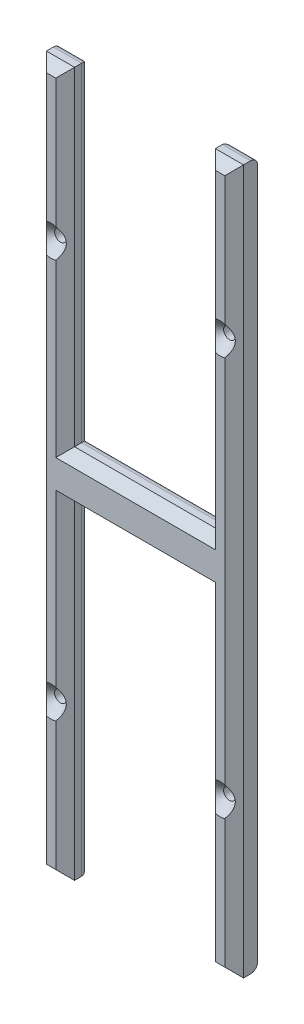
from build123d import *

# Parameters (mm, degrees)
SKETCH1_R           = 12.5
BOSS_EXTRUDE1_DEPTH = 50
CHAMFER1_SIZE       = 20
FILLET1_R           = 15
FILLET2_R           = 3


with BuildPart() as part:
    # Sketch1 → Boss-Extrude1 (new body)
    with BuildSketch(Plane.XY):
        Polygon((-210, 750), (-150, 750), (-150, 50), (150, 50), (150, 750), (210, 750), (210, -750), (150, -750), (150, -50), (-150, -50), (-150, -750), (-210, -750), align=None)
        with Locations((180, 425)):
            Circle(SKETCH1_R, mode=Mode.SUBTRACT)
        with Locations(Location((-180, 425, 0), (0, 0, 180))):
            Circle(SKETCH1_R, mode=Mode.SUBTRACT)
        with Locations(Location((180, -425, 0), (0, 0, 180))):
            Circle(SKETCH1_R, mode=Mode.SUBTRACT)
        with Locations((-180, -425)):
            Circle(SKETCH1_R, mode=Mode.SUBTRACT)
    extrude(amount=BOSS_EXTRUDE1_DEPTH)

    # Chamfer1
    # the kernel refuses this chamfer: 20 mm, written as the material it takes off along each edge
    with BuildSketch(Plane(origin=(-150, -50, 50), x_dir=(0.027495876610586317, 0, -0.9996219169112968), z_dir=(0, -1, 0)), Plane(origin=(150, -801.433659759, 50), x_dir=(-0.027495876610586317, 0, -0.9996219169112968), z_dir=(0, 1, 0)), Plane(origin=(150, 50, 50), x_dir=(-0.027495876610586317, 0, -0.9996219169112968), z_dir=(0, 1, 0)), Plane(origin=(-150, 801.433659759, 50), x_dir=(0.027495876610586317, 0, -0.9996219169112968), z_dir=(0, -1, 0))) as chamfer1_piece_1:
        Polygon((CHAMFER1_SIZE * 0.999621916911, -CHAMFER1_SIZE * 0.0274958766106), (-CHAMFER1_SIZE * 0.0274958766106, -CHAMFER1_SIZE * 0.999621916911), (0, 0), align=None)
    extrude(amount=751.433659759, mode=Mode.SUBTRACT)
    with BuildSketch(Plane(origin=(150, -50, 50), x_dir=(0, -0.027495876610586317, -0.9996219169112968), z_dir=(-1, 0, 0)), Plane(origin=(-150, 50, 50), x_dir=(0, 0.027495876610586317, -0.9996219169112968), z_dir=(1, 0, 0))) as chamfer1_piece_2:
        Polygon((CHAMFER1_SIZE * 0.999621916911, -CHAMFER1_SIZE * 0.0274958766106), (-CHAMFER1_SIZE * 0.0274958766106, -CHAMFER1_SIZE * 0.999621916911), (0, 0), align=None)
    extrude(amount=300, mode=Mode.SUBTRACT)
    with BuildSketch(Plane(origin=(261.433659759, -750, 50), x_dir=(0, -0.0274958766105877, -0.9996219169112968), z_dir=(-1, 0, 0)), Plane(origin=(98.566340241, 750, 50), x_dir=(0, 0.0274958766105877, -0.9996219169112968), z_dir=(1, 0, 0)), Plane(origin=(-261.433659759, 750, 50), x_dir=(0, 0.0274958766105877, -0.9996219169112968), z_dir=(1, 0, 0)), Plane(origin=(-98.566340241, -750, 50), x_dir=(0, -0.0274958766105877, -0.9996219169112968), z_dir=(-1, 0, 0))) as chamfer1_piece_3:
        Polygon((CHAMFER1_SIZE * 0.999621916911, -CHAMFER1_SIZE * 0.0274958766106), (-CHAMFER1_SIZE * 0.0274958766106, -CHAMFER1_SIZE * 0.999621916911), (0, 0), align=None)
    extrude(amount=162.867319519, mode=Mode.SUBTRACT)
    with BuildSketch(Plane(origin=(210, 801.433659759, 50), x_dir=(0.027495876610586317, 0, -0.9996219169112968), z_dir=(0, -1, 0)), Plane(origin=(-210, -801.433659759, 50), x_dir=(-0.027495876610586317, 0, -0.9996219169112968), z_dir=(0, 1, 0))) as chamfer1_piece_4:
        Polygon((CHAMFER1_SIZE * 0.999621916911, -CHAMFER1_SIZE * 0.0274958766106), (-CHAMFER1_SIZE * 0.0274958766106, -CHAMFER1_SIZE * 0.999621916911), (0, 0), align=None)
    extrude(amount=1602.867319519, mode=Mode.SUBTRACT)
    with BuildSketch(Plane(origin=(180, 425, 50), x_dir=(1, 0, 0), z_dir=(0, -1, 0))) as chamfer1_piece_5:
        Polygon((12.5, -CHAMFER1_SIZE), (12.5 + CHAMFER1_SIZE, 0), (12.5, 0), align=None)
    revolve(axis=Axis((180, 425, 50), (0, 0, 1)), mode=Mode.SUBTRACT)
    with BuildSketch(Plane(origin=(-180, 425, 50), x_dir=(-1, 0, 0), z_dir=(0, 1, 0))) as chamfer1_piece_6:
        Polygon((12.5, -CHAMFER1_SIZE), (12.5 + CHAMFER1_SIZE, 0), (12.5, 0), align=None)
    revolve(axis=Axis((-180, 425, 50), (0, 0, 1)), mode=Mode.SUBTRACT)
    with BuildSketch(Plane(origin=(180, -425, 50), x_dir=(-1, 0, 0), z_dir=(0, 1, 0))) as chamfer1_piece_7:
        Polygon((12.5, -CHAMFER1_SIZE), (12.5 + CHAMFER1_SIZE, 0), (12.5, 0), align=None)
    revolve(axis=Axis((180, -425, 50), (0, 0, 1)), mode=Mode.SUBTRACT)
    with BuildSketch(Plane(origin=(-180, -425, 50), x_dir=(1, 0, 0), z_dir=(0, -1, 0))) as chamfer1_piece_8:
        Polygon((12.5, -CHAMFER1_SIZE), (12.5 + CHAMFER1_SIZE, 0), (12.5, 0), align=None)
    revolve(axis=Axis((-180, -425, 50), (0, 0, 1)), mode=Mode.SUBTRACT)
    with BuildSketch(Plane(origin=(150, -50, 50), x_dir=(0, -0.027495876610586317, -0.9996219169112968), z_dir=(-1, 0, 0))) as chamfer1_piece_9a_section:
        Polygon((CHAMFER1_SIZE * 0.999621916911, -CHAMFER1_SIZE * 0.0274958766106), (-CHAMFER1_SIZE * 0.0274958766106, -CHAMFER1_SIZE * 0.999621916911), (0, 0), align=None)
    chamfer1_piece_9a = extrude(amount=351.433659759, mode=Mode.PRIVATE)
    chamfer1_piece_9a = split(chamfer1_piece_9a, bisect_by=Plane(origin=(-150, -43.404127464, 43.404127464), z_dir=(-1, 0, 0)), keep=Keep.TOP, mode=Mode.PRIVATE)
    with BuildSketch(Plane(origin=(-150, 1.433659759, 50), x_dir=(0.027495876610586317, 0, -0.9996219169112968), z_dir=(0, -1, 0))) as chamfer1_piece_9b_section:
        Polygon((CHAMFER1_SIZE * 0.999621916911, -CHAMFER1_SIZE * 0.0274958766106), (-CHAMFER1_SIZE * 0.0274958766106, -CHAMFER1_SIZE * 0.999621916911), (0, 0), align=None)
    chamfer1_piece_9b = extrude(amount=802.867319519, mode=Mode.PRIVATE)
    chamfer1_piece_9b = split(chamfer1_piece_9b, bisect_by=Plane(origin=(-156.595872536, -50, 43.404127464), z_dir=(0, 1, 0)), keep=Keep.TOP, mode=Mode.PRIVATE)
    chamfer1_piece_9 = chamfer1_piece_9a & chamfer1_piece_9b
    add(chamfer1_piece_9, mode=Mode.SUBTRACT)
    with BuildSketch(Plane(origin=(150, -801.433659759, 50), x_dir=(-0.027495876610586317, 0, -0.9996219169112968), z_dir=(0, 1, 0))) as chamfer1_piece_10a_section:
        Polygon((CHAMFER1_SIZE * 0.999621916911, -CHAMFER1_SIZE * 0.0274958766106), (-CHAMFER1_SIZE * 0.0274958766106, -CHAMFER1_SIZE * 0.999621916911), (0, 0), align=None)
    chamfer1_piece_10a = extrude(amount=802.867319519, mode=Mode.PRIVATE)
    chamfer1_piece_10a = split(chamfer1_piece_10a, bisect_by=Plane(origin=(156.595872536, -50, 43.404127464), z_dir=(0, 1, 0)), keep=Keep.TOP, mode=Mode.PRIVATE)
    with BuildSketch(Plane(origin=(201.433659759, -50, 50), x_dir=(0, -0.027495876610586317, -0.9996219169112968), z_dir=(-1, 0, 0))) as chamfer1_piece_10b_section:
        Polygon((CHAMFER1_SIZE * 0.999621916911, -CHAMFER1_SIZE * 0.0274958766106), (-CHAMFER1_SIZE * 0.0274958766106, -CHAMFER1_SIZE * 0.999621916911), (0, 0), align=None)
    chamfer1_piece_10b = extrude(amount=351.433659759, mode=Mode.PRIVATE)
    chamfer1_piece_10b = split(chamfer1_piece_10b, bisect_by=Plane(origin=(150, -43.404127464, 43.404127464), z_dir=(1, 0, 0)), keep=Keep.TOP, mode=Mode.PRIVATE)
    chamfer1_piece_10 = chamfer1_piece_10a & chamfer1_piece_10b
    add(chamfer1_piece_10, mode=Mode.SUBTRACT)
    with BuildSketch(Plane(origin=(-150, 50, 50), x_dir=(0, 0.027495876610586317, -0.9996219169112968), z_dir=(1, 0, 0))) as chamfer1_piece_11a_section:
        Polygon((CHAMFER1_SIZE * 0.999621916911, -CHAMFER1_SIZE * 0.0274958766106), (-CHAMFER1_SIZE * 0.0274958766106, -CHAMFER1_SIZE * 0.999621916911), (0, 0), align=None)
    chamfer1_piece_11a = extrude(amount=351.433659759, mode=Mode.PRIVATE)
    chamfer1_piece_11a = split(chamfer1_piece_11a, bisect_by=Plane(origin=(150, 43.404127464, 43.404127464), z_dir=(1, 0, 0)), keep=Keep.TOP, mode=Mode.PRIVATE)
    with BuildSketch(Plane(origin=(150, -1.433659759, 50), x_dir=(-0.027495876610586317, 0, -0.9996219169112968), z_dir=(0, 1, 0))) as chamfer1_piece_11b_section:
        Polygon((CHAMFER1_SIZE * 0.999621916911, -CHAMFER1_SIZE * 0.0274958766106), (-CHAMFER1_SIZE * 0.0274958766106, -CHAMFER1_SIZE * 0.999621916911), (0, 0), align=None)
    chamfer1_piece_11b = extrude(amount=802.867319519, mode=Mode.PRIVATE)
    chamfer1_piece_11b = split(chamfer1_piece_11b, bisect_by=Plane(origin=(156.595872536, 50, 43.404127464), z_dir=(0, -1, 0)), keep=Keep.TOP, mode=Mode.PRIVATE)
    chamfer1_piece_11 = chamfer1_piece_11a & chamfer1_piece_11b
    add(chamfer1_piece_11, mode=Mode.SUBTRACT)
    with BuildSketch(Plane(origin=(-150, 801.433659759, 50), x_dir=(0.027495876610586317, 0, -0.9996219169112968), z_dir=(0, -1, 0))) as chamfer1_piece_12a_section:
        Polygon((CHAMFER1_SIZE * 0.999621916911, -CHAMFER1_SIZE * 0.0274958766106), (-CHAMFER1_SIZE * 0.0274958766106, -CHAMFER1_SIZE * 0.999621916911), (0, 0), align=None)
    chamfer1_piece_12a = extrude(amount=802.867319519, mode=Mode.PRIVATE)
    chamfer1_piece_12a = split(chamfer1_piece_12a, bisect_by=Plane(origin=(-156.595872536, 50, 43.404127464), z_dir=(0, -1, 0)), keep=Keep.TOP, mode=Mode.PRIVATE)
    with BuildSketch(Plane(origin=(-201.433659759, 50, 50), x_dir=(0, 0.027495876610586317, -0.9996219169112968), z_dir=(1, 0, 0))) as chamfer1_piece_12b_section:
        Polygon((CHAMFER1_SIZE * 0.999621916911, -CHAMFER1_SIZE * 0.0274958766106), (-CHAMFER1_SIZE * 0.0274958766106, -CHAMFER1_SIZE * 0.999621916911), (0, 0), align=None)
    chamfer1_piece_12b = extrude(amount=351.433659759, mode=Mode.PRIVATE)
    chamfer1_piece_12b = split(chamfer1_piece_12b, bisect_by=Plane(origin=(-150, 43.404127464, 43.404127464), z_dir=(-1, 0, 0)), keep=Keep.TOP, mode=Mode.PRIVATE)
    chamfer1_piece_12 = chamfer1_piece_12a & chamfer1_piece_12b
    add(chamfer1_piece_12, mode=Mode.SUBTRACT)

    # Fillet1
    fillet1_edges = [part.edges().sort_by_distance(p)[0] for p in [
        (-180, 750, 0),
        (-150, 400, 0),
        (0, 50, 0),
        (150, 400, 0),
        (180, 750, 0),
        (180, -750, 0),
        (150, -400, 0),
        (0, -50, 0),
        (-150, -400, 0),
        (-180, -750, 0),
    ]]
    fillet(fillet1_edges, radius=FILLET1_R)

    # Fillet2
    fillet2_edges = [part.edges().sort_by_distance(p)[0] for p in [
        (167.5, 425, 0),
        (-167.5, 425, 0),
        (192.5, -425, 0),
        (-192.5, -425, 0),
    ]]
    fillet(fillet2_edges, radius=FILLET2_R)


solid = part.part
